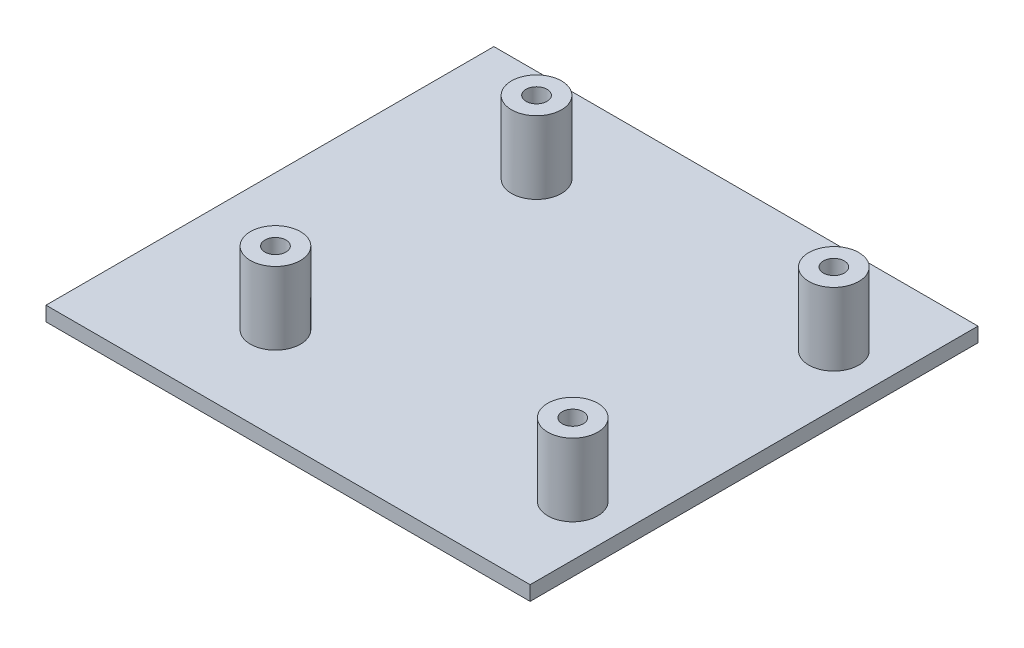
from build123d import *

# Parameters (mm, degrees)
SKETCH1_W           = 66.76
SKETCH1_H           = 61.76
BOSS_EXTRUDE3_DEPTH = 2
SKETCH2_R           = 3.45
SKETCH2_R_2         = 1.45
BOSS_EXTRUDE4_DEPTH = 10


with BuildPart() as part:
    # Sketch1 → Boss-Extrude3 (new body)
    with BuildSketch(Plane(origin=(0, 0, 0), x_dir=(1, 0, 0), z_dir=(0, 1, 0))):
        with Locations((33.38, 30.88)):
            Rectangle(SKETCH1_W, SKETCH1_H)
    extrude(amount=-BOSS_EXTRUDE3_DEPTH)

    # Sketch2 → Boss-Extrude4 (add)
    # profile 1 of 4: a face of its own
    with BuildSketch(Plane(origin=(0, 0, 0), x_dir=(1, 0, 0), z_dir=(0, 1, 0))):
        with Locations((59.76, 12.88)):
            Circle(SKETCH2_R)
        with Locations((59.76, 12.88)):
            Circle(SKETCH2_R_2, mode=Mode.SUBTRACT)
    # profile 2 of 4: a face of its own
    with BuildSketch(Plane(origin=(0, 0, 0), x_dir=(1, 0, 0), z_dir=(0, 1, 0))):
        with Locations((18.76, 12.88)):
            Circle(SKETCH2_R)
        with Locations((18.76, 12.88)):
            Circle(SKETCH2_R_2, mode=Mode.SUBTRACT)
    # profile 3 of 4: a face of its own
    with BuildSketch(Plane(origin=(0, 0, 0), x_dir=(1, 0, 0), z_dir=(0, 1, 0))):
        with Locations((59.76, 48.88)):
            Circle(SKETCH2_R)
        with Locations((59.76, 48.88)):
            Circle(SKETCH2_R_2, mode=Mode.SUBTRACT)
    # profile 4 of 4: a face of its own
    with BuildSketch(Plane(origin=(0, 0, 0), x_dir=(1, 0, 0), z_dir=(0, 1, 0))):
        with Locations((18.76, 48.88)):
            Circle(SKETCH2_R)
        with Locations((18.76, 48.88)):
            Circle(SKETCH2_R_2, mode=Mode.SUBTRACT)
    extrude(amount=BOSS_EXTRUDE4_DEPTH)


solid = part.part
